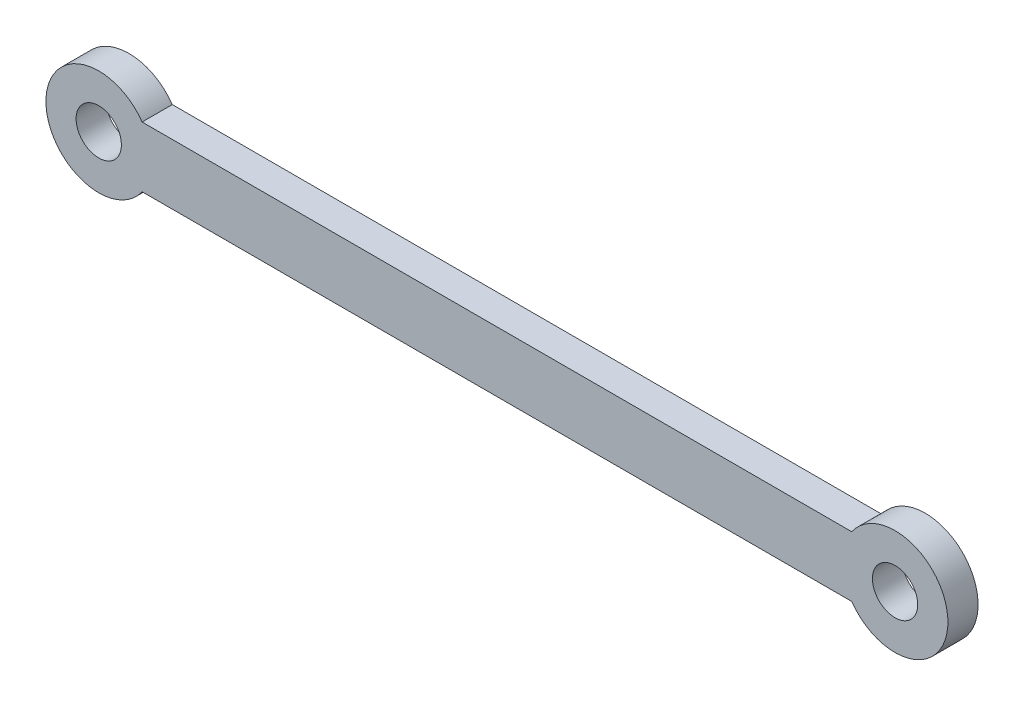
from build123d import *

# Parameters (mm, degrees)
CROQUIS1_R              = 1.5
SALIENTE_EXTRUIR1_DEPTH = 2


with BuildPart() as part:
    # Croquis1 → Saliente-Extruir1 (new body)
    with BuildSketch(Plane.XY):
        with BuildLine():
            Line((23.5, 2), (-23.5, 2))
            ThreePointArc((-23.5, 2), (-29.872281323, 0), (-23.5, -2))
            Line((-23.5, -2), (23.5, -2))
            ThreePointArc((23.5, -2), (29.872281323, 0), (23.5, 2))
        make_face()
        with Locations((-26.372281323, 0)):
            Circle(CROQUIS1_R, mode=Mode.SUBTRACT)
        with Locations((26.372281323, 0)):
            Circle(CROQUIS1_R, mode=Mode.SUBTRACT)
    extrude(amount=SALIENTE_EXTRUIR1_DEPTH)


solid = part.part
